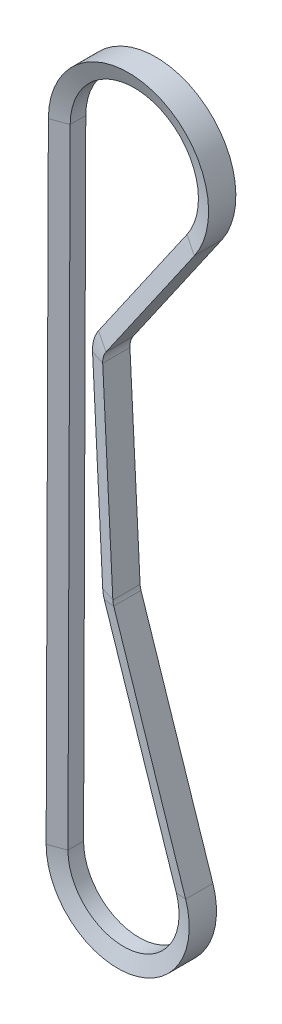
from build123d import *


with BuildPart() as part:
    # Sweep1: sweep along a path in Sketch2
    with BuildLine(Plane.XY) as sweep1_path:
        Line((-24.999846313, 0.087660376), (-24.22850673, 220.065852557))
        ThreePointArc((-24.22850673, 220.065852557), (12.177700749, 246.675963444), (26.779754489, 204.011107051))
        Line((26.779754489, 204.011107051), (-4.115662802, 159.461725019))
        ThreePointArc((-4.115662802, 159.461725019), (-5.004184419, 157.584580483), (-5.239516689, 155.521146211))
        Line((-5.239516689, 155.521146211), (-1.691479974, 85.611122355))
        ThreePointArc((-1.691479974, 85.611122355), (-1.591572819, 84.766446283), (-1.379674055, 83.94269995))
        Line((-1.379674055, 83.94269995), (23.740283306, 7.835748116))
        ThreePointArc((23.740283306, 7.835748116), (3.924900081, -24.689980951), (-24.999846313, 0.087660376))
    # Sketch3 → Sweep1 (sweep)
    with BuildSketch(Plane(origin=(23.740283306, 7.835748116, 0), x_dir=(-0.9496113322578456, -0.3134299246202887, 0), z_dir=(0.3134299246202887, -0.9496113322578456, 0))):
        Polygon((0, -4.7625), (0, 4.7625), (5.588, 2.728634331), (5.588, -2.728634331), align=None)
    sweep(path=sweep1_path.line)


solid = part.part
